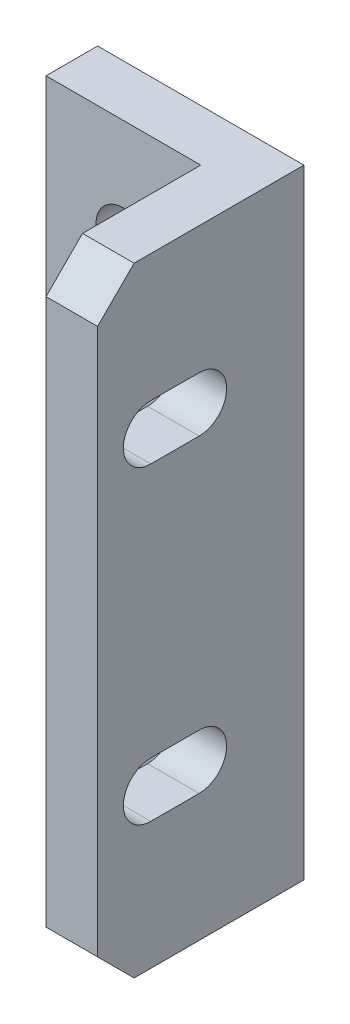
from build123d import *

# Parameters (mm, degrees)
SKETCH1_W                   = 25.4
SKETCH1_H                   = 76.2
BOSS_EXTRUDE1_DEPTH         = 6.35
BOSS_EXTRUDE2_DEPTH         = 6.35
F_1_4_START                 = 19.05
F_1_4_CLEARANCE_SLOT1_DEPTH = 6.35
F_1_4_CLEARANCE_HOLE1_D     = 6.7564


# Read off the part's stored shape, not the designer's step: 1/4 Clearance Slot1
with BuildPart() as part:
    # Sketch1 → Boss-Extrude1 (new body)
    with BuildSketch(Plane.XY):
        with Locations((12.7, 38.1)):
            Rectangle(SKETCH1_W, SKETCH1_H)
    extrude(amount=BOSS_EXTRUDE1_DEPTH)

    # Sketch2 → Boss-Extrude2 (add)
    with BuildSketch(Plane(origin=(25.4, 0, 0), x_dir=(0, 0, -1), z_dir=(1, 0, 0))):
        Polygon((-6.35, 76.2), (-6.35, 0), (-20.909871939, 0), (-25.4, 4.490128061), (-25.4, 71.709871939), (-20.909871939, 76.2), align=None)
    extrude(amount=-BOSS_EXTRUDE2_DEPTH)

    # 1/4 Clearance Slot1 outline → 1/4 Clearance Slot1 (cut)
    with BuildSketch(Plane.YZ.offset(F_1_4_START)):
        with BuildLine():
            ThreePointArc((22.4282, 18.8468), (19.05, 22.225), (15.6718, 18.8468))
            Line((15.6718, 18.8468), (15.6718, 12.9032))
            ThreePointArc((15.6718, 12.9032), (19.05, 9.525), (22.4282, 12.9032))
            Line((22.4282, 12.9032), (22.4282, 18.8468))
        make_face()
        with BuildLine():
            ThreePointArc((60.5282, 18.8468), (57.15, 22.225), (53.7718, 18.8468))
            Line((53.7718, 18.8468), (53.7718, 12.9032))
            ThreePointArc((53.7718, 12.9032), (57.15, 9.525), (60.5282, 12.9032))
            Line((60.5282, 12.9032), (60.5282, 18.8468))
        make_face()
    extrude(amount=F_1_4_CLEARANCE_SLOT1_DEPTH, mode=Mode.SUBTRACT)

    # 1/4 Clearance Hole1 (through all)
    with Locations(Plane.XY.offset(6.35)):
        with Locations((9.525, 63.5), (9.525, 12.7)):
            Hole(F_1_4_CLEARANCE_HOLE1_D / 2)


solid = part.part
